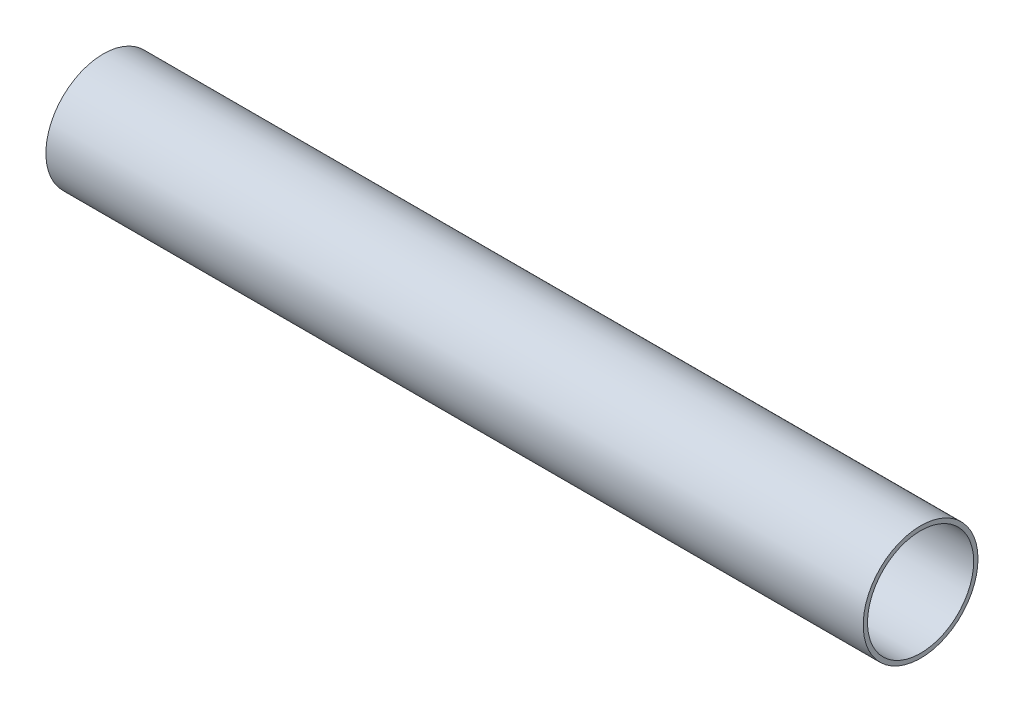
from build123d import *

# Parameters (mm, degrees)
SKETCH1_R           = 17.171437949
SKETCH1_R_2         = 15.875
BOSS_EXTRUDE1_DEPTH = 122.221625


with BuildPart() as part:
    # Sketch1 → Boss-Extrude1 (new, symmetric)
    with BuildSketch(Plane(origin=(0, 0, 0), x_dir=(0, 0, -1), z_dir=(1, 0, 0))):
        Circle(SKETCH1_R)
        Circle(SKETCH1_R_2, mode=Mode.SUBTRACT)
    extrude(amount=BOSS_EXTRUDE1_DEPTH, both=True)


solid = part.part
